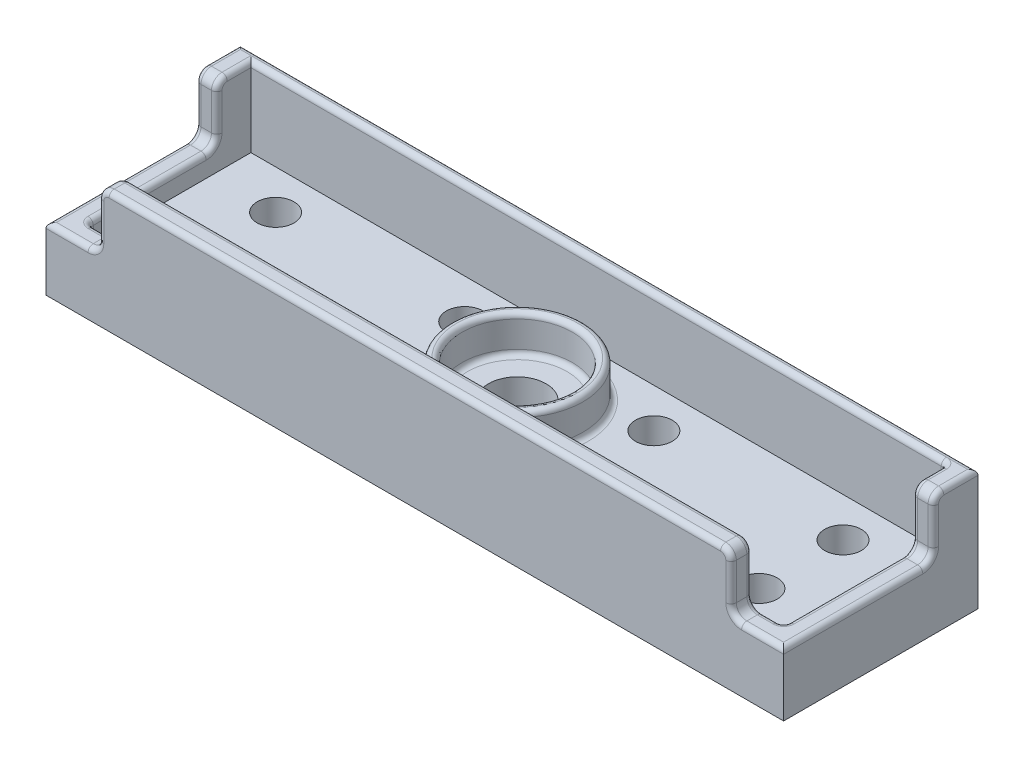
from build123d import *

# Parameters (mm, degrees)
SKETCH1_W           = 35.1
SKETCH1_H           = 18.5
BOSS_EXTRUDE1_DEPTH = 11.5
SKETCH7_W           = 33.1
SKETCH7_H           = 15.5
CUT_EXTRUDE5_DEPTH  = 7.5
SKETCH2_R           = 1.75
CUT_EXTRUDE1_DEPTH  = 39.076534769
SKETCH4_W           = 14.25
SKETCH4_H           = 5.5
CUT_EXTRUDE3_DEPTH  = 5
SKETCH5_R           = 2.75
CUT_EXTRUDE4_DEPTH  = 39.076534769
SKETCH6_R           = 6.25
SKETCH6_R_2         = 5.25
BOSS_EXTRUDE2_DEPTH = 3.5
FILLET3_R           = 1
FILLET4_R           = 0.5
FILLET5_R           = 0.5


with BuildPart() as part:
    # Sketch1 → Boss-Extrude1 (new body)
    with BuildSketch(Plane(origin=(0, 0, 0), x_dir=(1, 0, 0), z_dir=(0, 1, 0))):
        with Locations((-17.55, 0)):
            Rectangle(SKETCH1_W, SKETCH1_H)
    extrude(amount=BOSS_EXTRUDE1_DEPTH)

    # Sketch7 → Cut-Extrude5 (cut)
    with BuildSketch(Plane(origin=(0, 11.5, 0), x_dir=(1, 0, 0), z_dir=(0, 1, 0))):
        with Locations((-16.55, 0.5)):
            Rectangle(SKETCH7_W, SKETCH7_H)
    extrude(amount=-CUT_EXTRUDE5_DEPTH, mode=Mode.SUBTRACT)

    # Sketch2 → Cut-Extrude1 (cut, through all)
    with BuildSketch(Plane(origin=(0, 0, 0), x_dir=(-1, 0, 0), z_dir=(0, 1, 0))):
        with Locations(Location((27, 3.5, 0), (0, 0, 270))):
            Circle(SKETCH2_R)
        with Locations(Location((9, 3.5, 0), (0, 0, 270))):
            Circle(SKETCH2_R)
        with Locations(Location((27, -4.5, 0), (0, 0, 270))):
            Circle(SKETCH2_R)
        with Locations(Location((9, -4.5, 0), (0, 0, 270))):
            Circle(SKETCH2_R)
    extrude(amount=CUT_EXTRUDE1_DEPTH, mode=Mode.SUBTRACT)

    # Sketch4 → Cut-Extrude3 (cut)
    with BuildSketch(Plane.ZY.offset(35.1)):
        with Locations((2.125, 8.75)):
            Rectangle(SKETCH4_W, SKETCH4_H)
    extrude(amount=-CUT_EXTRUDE3_DEPTH, mode=Mode.SUBTRACT)

    # Mirror1: part across plane


with BuildPart() as part_1:
    add(part.part)
    add(part.part.mirror(Plane(origin=(0, 0, 0), x_dir=(0, 0, 1), z_dir=(1, 0, 0))))

    # Sketch5 → Cut-Extrude4 (cut, through all)
    with BuildSketch(Plane(origin=(0, 0, 0), x_dir=(1, 0, 0), z_dir=(0, 1, 0))):
        with Locations(Location((0, 0.5, 0), (0, 0, 90))):
            Circle(SKETCH5_R)
    extrude(amount=CUT_EXTRUDE4_DEPTH, mode=Mode.SUBTRACT)

    # Sketch6 → Boss-Extrude2 (add)
    with BuildSketch(Plane(origin=(0, 4, 0), x_dir=(1, 0, 0), z_dir=(0, 1, 0))):
        with Locations(Location((0, 0.5, 0), (0, 0, 90))):
            Circle(SKETCH6_R)
        with Locations(Location((0, 0.5, 0), (0, 0, 270))):
            Circle(SKETCH6_R_2, mode=Mode.SUBTRACT)
    extrude(amount=BOSS_EXTRUDE2_DEPTH)

    # Fillet3
    fillet3_edges = [part_1.edges().sort_by_distance(p)[0] for p in [
        (-34.1, 6, -5),
        (-34.1, 11.5, -5),
        (-30.1, 11.5, 8.25),
        (-30.1, 6, 8.25),
        (34.1, 11.5, -5),
        (34.1, 6, -5),
        (30.1, 11.5, 8.25),
        (30.1, 6, 8.25),
    ]]
    fillet(fillet3_edges, radius=FILLET3_R)

    # Fillet4
    fillet4_edges = [part_1.edges().sort_by_distance(p)[0] for p in [
        (0, 4, 5.75),
        (0, 4, -5.75),
    ]]
    fillet(fillet4_edges, radius=FILLET4_R)
    fillet4_2_edges = [part_1.edges().sort_by_distance(p)[0] for p in [
        (0, 7.5, 5.75),
        (0, 7.5, -5.75),
    ]]
    fillet(fillet4_2_edges, radius=FILLET4_R - 0.0001)  # a hair under: the kernel refuses the full size

    # Fillet5
    fillet5_edges = [part_1.edges().sort_by_distance(p)[0] for p in [
        (30.1, 8.75, 7.25),
        (30.1, 8.75, 9.25),
        (-30.1, 8.75, 9.25),
        (-33.1, 6, 9.25),
        (33.1, 6, 9.25),
        (0, 11.5, 9.25),
        (-29.807106781, 11.207106781, 9.25),
        (29.807106781, 11.207106781, 9.25),
        (0, 11.5, 7.25),
        (-30.1, 8.75, 7.25),
        (-29.807106781, 11.207106781, 7.25),
        (29.807106781, 11.207106781, 7.25),
        (33.1, 6, 1.625),
        (35.1, 6, 2.625),
        (-35.1, 6, 2.625),
        (-33.1, 6, 1.625),
        (-35.1, 11.5, -7.625),
        (35.1, 8.75, -5),
        (35.1, 11.207106781, -5.292893219),
        (33.1, 8.75, -5),
        (33.1, 11.207106781, -5.292893219),
        (-35.1, 8.75, -5),
        (-33.1, 8.75, -5),
        (-35.1, 11.207106781, -5.292893219),
        (-33.1, 11.207106781, -5.292893219),
        (30.392893219, 6.292893219, 7.25),
        (30.392893219, 6.292893219, 9.25),
        (-30.392893219, 6.292893219, 7.25),
        (-30.392893219, 6.292893219, 9.25),
        (35.1, 6.292893219, -4.707106781),
        (33.1, 6.292893219, -4.707106781),
        (-35.1, 6.292893219, -4.707106781),
        (-33.1, 6.292893219, -4.707106781),
        (0, 11.5, -8.25),
        (-33.1, 11.5, -7.125),
        (-33.1, 5, 7.25),
        (-32.1, 6, 7.25),
        (35.1, 11.5, -7.625),
        (33.1, 11.5, -7.125),
        (33.1, 7.75, -8.25),
        (33.1, 5, 7.25),
        (32.1, 6, 7.25),
        (0, 11.5, -9.25),
    ]]
    fillet(fillet5_edges, radius=FILLET5_R - 0.0001)  # a hair under: the kernel refuses the full size


solid = part_1.part
